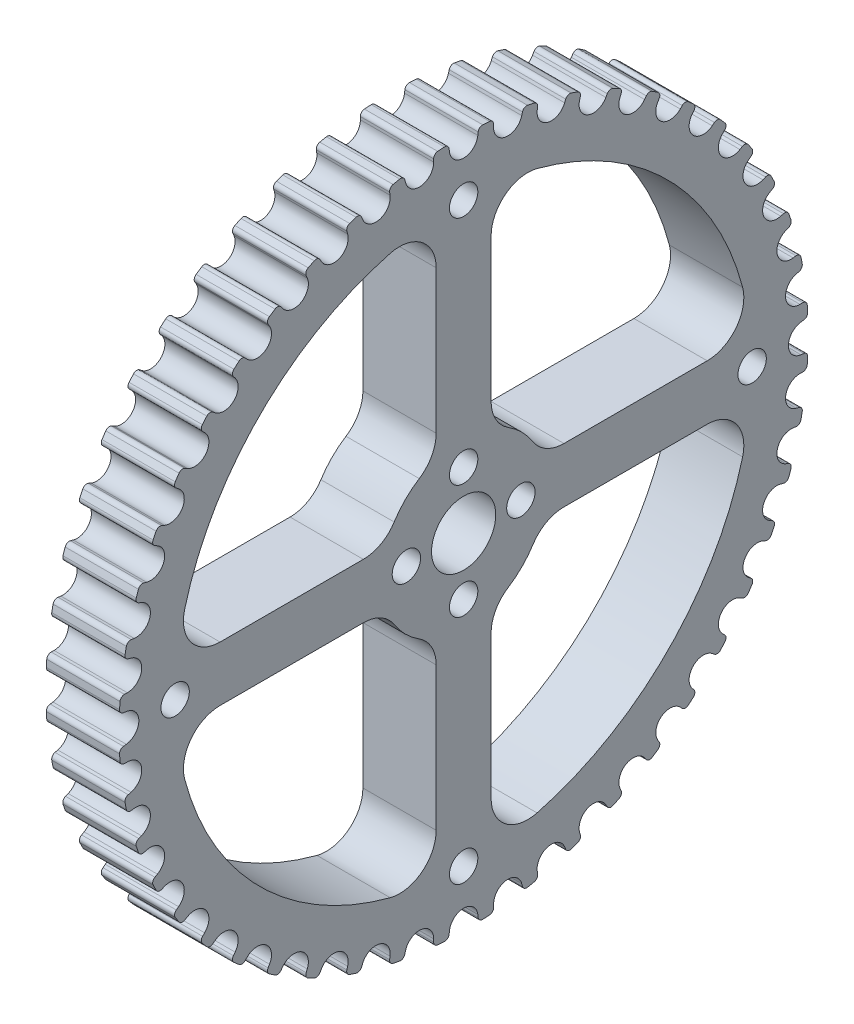
from build123d import *

# Parameters (mm, degrees)
CHAMFER_1_SIZE           = 1
SKETCH_4_W               = 5
SKETCH_4_H               = 2.299999953
CUT_EXTRUDE_1_DEPTH      = 61.124705887
CUT_EXTRUDE_2_REACH      = 62.125
PATTERN_CIRCULAR_3_COUNT = 48
SKETCH_7_R               = 40
CUT_EXTRUDE_3_DEPTH      = 20
CUT_EXTRUDE_9_DEPTH      = 10
FILLET_1_R               = 4
SKETCH_16_R              = 1.55
CUT_EXTRUDE_10_DEPTH     = 10
EXTRUDE_START            = -8
SKETCH_19_R              = 3.505
EXTRUDE_1_DEPTH          = 8
SKETCH_20_R              = 1.55
CUT_EXTRUDE_11_DEPTH     = 8


with BuildPart() as part:
    # 草图1 → 旋转1 (revolve)
    with BuildSketch(Plane.XY, mode=Mode.PRIVATE) as revolve_1_sk:
        Polygon((0, 7.0476), (0, 37.623), (28, 37.623), (28, 14.0952), (20, 14.0952), (20, 7.0476), align=None)
    revolve(revolve_1_sk.sketch.rotate(Axis((0, 0, 0), (1, 0, 0)), 90), axis=Axis((0, 0, 0), (1, 0, 0)))

    # 倒角1
    chamfer_1_edges = [part.edges().sort_by_distance(p)[0] for p in [
        (0, 0, -7.0476),
        (20, 0, -7.0476),
    ]]
    chamfer(chamfer_1_edges, length=CHAMFER_1_SIZE)

    # 草图4 → 切除-拉伸1 (cut, through all)
    with BuildSketch(Plane.ZY):
        with Locations((0, 7.739284138)):
            Rectangle(SKETCH_4_W, SKETCH_4_H)
    extrude(amount=-CUT_EXTRUDE_1_DEPTH, mode=Mode.SUBTRACT)

    # 草图6 → 切除-拉伸2 (cut, up to next)
    with BuildSketch(Plane(origin=(0, 0, 0), x_dir=(0, 0, -1), z_dir=(1, 0, 0)), mode=Mode.PRIVATE) as cut_extrude_2_sk1:
        with BuildLine():
            Line((1.586591976, 37.144160575), (1.548371997, 36.832883824))
            ThreePointArc((1.548371997, 36.832883824), (0, 35.463), (-1.548371997, 36.832883824))
            Line((-1.548371997, 36.832883824), (-1.586591976, 37.144160575))
            ThreePointArc((-1.586591976, 37.144160575), (-1.755066854, 37.453859537), (-2.089674516, 37.564922327))
            ThreePointArc((-2.089674516, 37.564922327), (-2.329261517, 37.550827818), (-2.568753733, 37.535205251))
            Line((-2.568753733, 37.535205251), (-2.765401721, 39.136774594))
            ThreePointArc((-2.765401721, 39.136774594), (0, 39.23435449), (2.765401721, 39.136774594))
            Line((2.765401721, 39.136774594), (2.568753733, 37.535205251))
            ThreePointArc((2.568753733, 37.535205251), (2.329261517, 37.550827818), (2.089674516, 37.564922327))
            ThreePointArc((2.089674516, 37.564922327), (1.755066854, 37.453859537), (1.586591976, 37.144160575))
        make_face()
    cut_extrude_2_tool1 = extrude(cut_extrude_2_sk1.sketch, amount=CUT_EXTRUDE_2_REACH, mode=Mode.PRIVATE) & part.part
    cut_extrude_2 = cut_extrude_2_tool1.solids().sort_by_distance((0, 37.715945, 0))[0]
    add(cut_extrude_2, mode=Mode.SUBTRACT)

    # 阵列(圆周)3: 切除-拉伸2 ×48 about axis
    pattern_circular_3_axis = Axis((0, 0, 0), (1, 0, 0))
    for i in range(1, PATTERN_CIRCULAR_3_COUNT):
        add(cut_extrude_2.rotate(pattern_circular_3_axis, i * 360 / PATTERN_CIRCULAR_3_COUNT), mode=Mode.SUBTRACT)

    # 草图7 → 切除-拉伸3 (cut)
    with BuildSketch(Plane(origin=(28, 0, 0), x_dir=(0, 0, -1), z_dir=(1, 0, 0))):
        Circle(SKETCH_7_R)
    extrude(amount=-CUT_EXTRUDE_3_DEPTH, mode=Mode.SUBTRACT)

    # 草图15 → 切除-拉伸9 (cut)
    with BuildSketch(Plane(origin=(8, 0, 0), x_dir=(0, 0, -1), z_dir=(1, 0, 0))):
        with BuildLine():
            Line((3, -8.485281374), (3, -31.356817441))
            ThreePointArc((3, -31.356817441), (22.273863607, -22.273863607), (31.356817441, -3))
            Line((31.356817441, -3), (8.485281374, -3))
            ThreePointArc((8.485281374, -3), (6.363961031, -6.363961031), (3, -8.485281374))
        make_face()
        with BuildLine():
            ThreePointArc((31.356817441, 3), (22.273863607, 22.273863607), (3, 31.356817441))
            Line((3, 31.356817441), (3, 8.485281374))
            ThreePointArc((3, 8.485281374), (6.363961031, 6.363961031), (8.485281374, 3))
            Line((8.485281374, 3), (31.356817441, 3))
        make_face()
        with BuildLine():
            ThreePointArc((-3, 31.356817441), (-22.273863607, 22.273863607), (-31.356817441, 3))
            Line((-31.356817441, 3), (-8.485281374, 3))
            ThreePointArc((-8.485281374, 3), (-6.363961031, 6.363961031), (-3, 8.485281374))
            Line((-3, 8.485281374), (-3, 31.356817441))
        make_face()
        with BuildLine():
            Line((-8.485281374, -3), (-31.356817441, -3))
            ThreePointArc((-31.356817441, -3), (-22.273863607, -22.273863607), (-3, -31.356817441))
            Line((-3, -31.356817441), (-3, -8.485281374))
            ThreePointArc((-3, -8.485281374), (-6.363961031, -6.363961031), (-8.485281374, -3))
        make_face()
    extrude(amount=-CUT_EXTRUDE_9_DEPTH, mode=Mode.SUBTRACT)

    # 圆角1
    fillet_1_edges = [part.edges().sort_by_distance(p)[0] for p in [
        (4, -3, 8.485281374),
        (4, -8.485281374, 3),
        (4, -31.356817441, 3),
        (4, -3, 31.356817441),
        (4, 8.485281374, 3),
        (4, 3, 8.485281374),
        (4, 3, 31.356817441),
        (4, 31.356817441, 3),
        (4, 3, -8.485281374),
        (4, 8.485281374, -3),
        (4, 31.356817441, -3),
        (4, 3, -31.356817441),
        (4, -8.485281374, -3),
        (4, -3, -8.485281374),
        (4, -3, -31.356817441),
        (4, -31.356817441, -3),
    ]]
    fillet(fillet_1_edges, radius=FILLET_1_R)

    # 草图16 → 切除-拉伸10 (cut)
    with BuildSketch(Plane(origin=(8, 0, 0), x_dir=(0, 0, -1), z_dir=(1, 0, 0))):
        with Locations((31.5, 0)):
            Circle(SKETCH_16_R)
        with Locations((0, 31.5)):
            Circle(SKETCH_16_R)
        with Locations((-31.5, 0)):
            Circle(SKETCH_16_R)
        with Locations((0, -31.5)):
            Circle(SKETCH_16_R)
    extrude(amount=-CUT_EXTRUDE_10_DEPTH, mode=Mode.SUBTRACT)

    # 草图19 → 凸台-拉伸1 (add)
    with BuildSketch(Plane.ZY.offset(EXTRUDE_START)):
        with BuildLine():
            Line((-2.5, 8.889284114), (-2.5, 8.645808233))
            ThreePointArc((-2.5, 8.645808233), (0, -9), (2.5, 8.645808233))
            Line((2.5, 8.645808233), (2.5, 8.889284114))
            Line((2.5, 8.889284114), (-2.5, 8.889284114))
        make_face()
        Circle(SKETCH_19_R, mode=Mode.SUBTRACT)
    extrude(amount=EXTRUDE_1_DEPTH)

    # 草图20 → 切除-拉伸11 (cut)
    with BuildSketch(Plane.ZY):
        with Locations((0, 6.25)):
            Circle(SKETCH_20_R)
        with Locations((6.25, 0)):
            Circle(SKETCH_20_R)
        with Locations((0, -6.25)):
            Circle(SKETCH_20_R)
        with Locations((-6.25, 0)):
            Circle(SKETCH_20_R)
    extrude(amount=-CUT_EXTRUDE_11_DEPTH, mode=Mode.SUBTRACT)


solid = part.part
